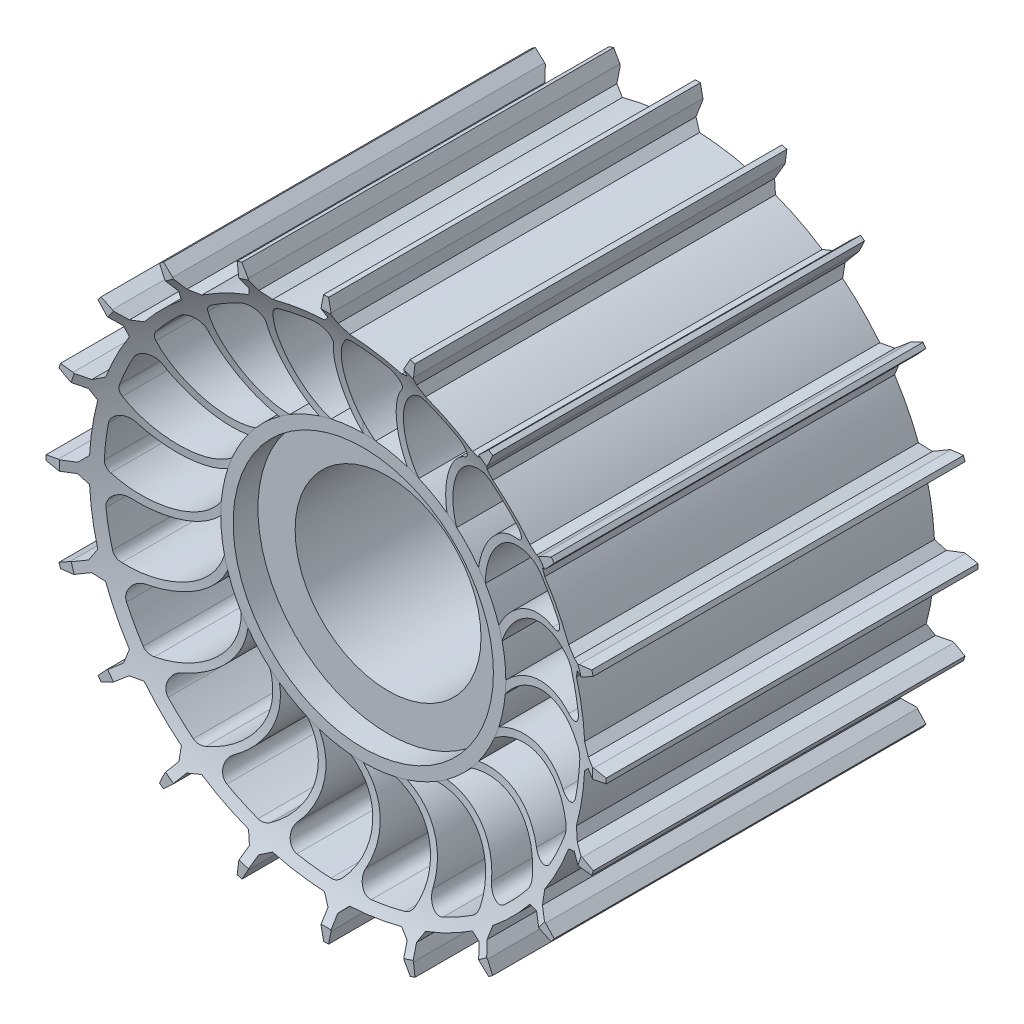
from build123d import *
from OCP.BRepFilletAPI import BRepFilletAPI_MakeChamfer

# Parameters (mm, degrees)
SKETCH1_R                      = 100
SKETCH1_R_2                    = 96
BOSS_EXTRUDE1_DEPTH            = 75
SKETCH2_W                      = 4
SKETCH2_H                      = 15
BOSS_EXTRUDE2_DEPTH            = 75
CHAMFER1_SIZE                  = 3
CHAMFER1_SIZE_2                = 3.06184942
CHAMFER2_SIZE                  = 5
CHAMFER2_SIZE2                 = 1
CIRPATTERN1_COUNT              = 20
CHAMFER1_OF_CIRPATTERN1_SIZE   = 3
CHAMFER1_OF_CIRPATTERN1_SIZE_2 = 3.06184942
CHAMFER2_OF_CIRPATTERN1_SIZE   = 5
CHAMFER2_OF_CIRPATTERN1_SIZE2  = 1
BOSS_EXTRUDE3_DEPTH            = 75
FILLET1_R                      = 5
CIRPATTERN3_COUNT              = 20
FILLET1_OF_CIRPATTERN3_R       = 5
SKETCH4_R                      = 57.5
SKETCH4_R_2                    = 37.5
BOSS_EXTRUDE4_DEPTH            = 60
SKETCH5_R                      = 52.5
CUT_EXTRUDE1_DEPTH             = 10


with BuildPart() as part:
    # Sketch1 → Boss-Extrude1 (new, symmetric)
    with BuildSketch(Plane.XY):
        Circle(SKETCH1_R)
        Circle(SKETCH1_R_2, mode=Mode.SUBTRACT)
    extrude(amount=BOSS_EXTRUDE1_DEPTH, both=True)

    # Sketch2 → Boss-Extrude2 (add, symmetric)
    with BuildSketch(Plane.XY):
        with Locations((0, 105.5)):
            Rectangle(SKETCH2_W, SKETCH2_H)
    boss_extrude2 = extrude(amount=BOSS_EXTRUDE2_DEPTH, both=True)

    # Chamfer1
    # the kernel refuses this chamfer: 3.06184942, 3 mm, written as the material it adds along each edge
    with BuildSketch(Plane(origin=(2, 99.979998, -75), x_dir=(0.9993676250587352, -0.03555769936965834, 0), z_dir=(0, 0, 1))) as chamfer1_piece_1:
        with BuildLine():
            Line((3.112646923, 0), (-CHAMFER1_SIZE * 0.0355576993697, CHAMFER1_SIZE * 0.999367625059))
            Line((-CHAMFER1_SIZE * 0.0355576993697, CHAMFER1_SIZE * 0.999367625059), (0, 0))
            ThreePointArc((0, 0), (1.601160995, 0.012101395), (3.112646923, 0))
        make_face()
    extrude(amount=150)
    with BuildSketch(Plane(origin=(-2, 99.979998, -75), x_dir=(-0.9993792848189881, -0.035228469661455174, 0), z_dir=(0, 0, 1))) as chamfer1_piece_2:
        with BuildLine():
            Line((3.046767513, 0), (-CHAMFER1_SIZE_2 * 0.035228469656, -CHAMFER1_SIZE_2 * 0.999379284664))
            Line((-CHAMFER1_SIZE_2 * 0.035228469656, -CHAMFER1_SIZE_2 * 0.999379284664), (0, 0))
            ThreePointArc((0, 0), (1.567363314, -0.011594493), (3.046767513, 0))
        make_face()
    extrude(amount=150)

    # Chamfer2: one chamfer whose edges measure the first distance from different faces: ONE call of the kernel's chamfer builder (chamfer() names one face for all edges)
    chamfer2_edges_1 = [part.edges().sort_by_distance(p)[0] for p in [
        (-2, 113, 0),
    ]]
    chamfer2_side_1 = [part.faces().sort_by_distance(p)[0] for p in [
        (-2, 108.02092371, 0),
    ]]
    chamfer2_edges_2 = [part.edges().sort_by_distance(p)[0] for p in [
        (2, 113, 0),
    ]]
    chamfer2_side_2 = [part.faces().sort_by_distance(p)[0] for p in [
        (2, 107.989999, 0),
    ]]
    chamfer2 = BRepFilletAPI_MakeChamfer(part.part.solid().wrapped)
    for e in chamfer2_edges_1:
        chamfer2.Add(CHAMFER2_SIZE, CHAMFER2_SIZE2, e.wrapped, chamfer2_side_1[0].wrapped)  # the first distance lies on this face
    for e in chamfer2_edges_2:
        chamfer2.Add(CHAMFER2_SIZE, CHAMFER2_SIZE2, e.wrapped, chamfer2_side_2[0].wrapped)  # the first distance lies on this face
    add(Compound.cast(chamfer2.Shape()), mode=Mode.REPLACE)

    # CirPattern1: Boss-Extrude2 ×20 about axis
    cirpattern1_axis = Axis((0, 0, 0), (0, 0, 1))
    for i in range(1, CIRPATTERN1_COUNT):
        add(boss_extrude2.rotate(cirpattern1_axis, i * 360 / CIRPATTERN1_COUNT))

    # Chamfer1 of CirPattern1
    # the kernel refuses this chamfer: 3.06184942, 3 mm, written as the material it adds along each edge
    with BuildSketch(Plane(origin=(-28.993405447, 95.704662585, -75), x_dir=(0.9614430253726217, 0.2750041980813028, 0), z_dir=(0, 0, 1)), Plane(origin=(-57.14873436, 82.061087984, -75), x_dir=(0.8294056835955822, 0.5586467685571493, 0), z_dir=(0, 0, 1)), Plane(origin=(-79.709946975, 60.384802337, -75), x_dir=(0.6161803346990081, 0.7876051010057122, 0), z_dir=(0, 0, 1)), Plane(origin=(-94.468594608, 32.797631512, -75), x_dir=(0.34263896146126266, 0.9394671586004203, 0), z_dir=(0, 0, 1)), Plane(origin=(-99.979998, 2, -75), x_dir=(0.03555769936965816, 0.9993676250587354, 0), z_dir=(0, 0, 1)), Plane(origin=(-95.704662585, -28.993405447, -75), x_dir=(-0.2750041980812937, 0.9614430253726242, 0), z_dir=(0, 0, 1)), Plane(origin=(-82.061087984, -57.14873436, -75), x_dir=(-0.5586467685571503, 0.8294056835955814, 0), z_dir=(0, 0, 1)), Plane(origin=(-60.384802337, -79.709946975, -75), x_dir=(-0.7876051010057117, 0.6161803346990089, 0), z_dir=(0, 0, 1)), Plane(origin=(-32.797631512, -94.468594608, -75), x_dir=(-0.939467158600422, 0.3426389614612583, 0), z_dir=(0, 0, 1)), Plane(origin=(-2, -99.979998, -75), x_dir=(-0.9993676250587352, 0.03555769936965854, 0), z_dir=(0, 0, 1)), Plane(origin=(28.993405447, -95.704662585, -75), x_dir=(-0.9614430253726228, -0.2750041980812989, 0), z_dir=(0, 0, 1)), Plane(origin=(57.14873436, -82.061087984, -75), x_dir=(-0.8294056835955806, -0.5586467685571513, 0), z_dir=(0, 0, 1)), Plane(origin=(79.709946975, -60.384802337, -75), x_dir=(-0.6161803346990089, -0.7876051010057117, 0), z_dir=(0, 0, 1)), Plane(origin=(94.468594608, -32.797631512, -75), x_dir=(-0.34263896146125755, -0.9394671586004223, 0), z_dir=(0, 0, 1)), Plane(origin=(99.979998, -2, -75), x_dir=(-0.035557699369658066, -0.9993676250587354, 0), z_dir=(0, 0, 1)), Plane(origin=(95.704662585, 28.993405447, -75), x_dir=(0.27500419808129795, -0.961443025372623, 0), z_dir=(0, 0, 1)), Plane(origin=(82.061087984, 57.14873436, -75), x_dir=(0.558646768557146, -0.8294056835955842, 0), z_dir=(0, 0, 1)), Plane(origin=(60.384802337, 79.709946975, -75), x_dir=(0.7876051010057096, -0.6161803346990117, 0), z_dir=(0, 0, 1)), Plane(origin=(32.797631512, 94.468594608, -75), x_dir=(0.9394671586004216, -0.3426389614612594, 0), z_dir=(0, 0, 1))) as chamfer1_of_cirpattern1_piece_1:
        with BuildLine():
            Line((3.112646923, 0), (-CHAMFER1_OF_CIRPATTERN1_SIZE * 0.0355576993697, CHAMFER1_OF_CIRPATTERN1_SIZE * 0.999367625059))
            Line((-CHAMFER1_OF_CIRPATTERN1_SIZE * 0.0355576993697, CHAMFER1_OF_CIRPATTERN1_SIZE * 0.999367625059), (0, 0))
            ThreePointArc((0, 0), (1.601160995, 0.012101395), (3.112646923, 0))
        make_face()
    extrude(amount=150)
    with BuildSketch(Plane(origin=(-32.797631512, 94.468594608, -75), x_dir=(-0.30901699437494673, 0.9510565162951538, 0), z_dir=(0, 0, 1)), Plane(origin=(-60.384802337, 79.709946975, -75), x_dir=(-0.5877852522924742, 0.8090169943749466, 0), z_dir=(0, 0, 1)), Plane(origin=(-82.061087984, 57.14873436, -75), x_dir=(-0.8090169943749477, 0.5877852522924727, 0), z_dir=(0, 0, 1)), Plane(origin=(-95.704662585, 28.993405447, -75), x_dir=(-0.9510565162951536, 0.30901699437494734, 0), z_dir=(0, 0, 1)), Plane(origin=(-99.979998, -2, -75), x_dir=(-1, 0, 0), z_dir=(0, 0, 1)), Plane(origin=(-94.468594608, -32.797631512, -75), x_dir=(-0.9510565162951534, -0.3090169943749481, 0), z_dir=(0, 0, 1)), Plane(origin=(-79.709946975, -60.384802337, -75), x_dir=(-0.8090169943749477, -0.5877852522924727, 0), z_dir=(0, 0, 1)), Plane(origin=(-57.14873436, -82.061087984, -75), x_dir=(-0.5877852522924727, -0.8090169943749477, 0), z_dir=(0, 0, 1)), Plane(origin=(-28.993405447, -95.704662585, -75), x_dir=(-0.30901699437494884, -0.9510565162951531, 0), z_dir=(0, 0, 1)), Plane(origin=(2, -99.979998, -75), x_dir=(0, -1, 0), z_dir=(0, 0, 1)), Plane(origin=(32.797631512, -94.468594608, -75), x_dir=(0.30901699437494595, -0.951056516295154, 0), z_dir=(0, 0, 1)), Plane(origin=(60.384802337, -79.709946975, -75), x_dir=(0.5877852522924736, -0.8090169943749471, 0), z_dir=(0, 0, 1)), Plane(origin=(82.061087984, -57.14873436, -75), x_dir=(0.8090169943749477, -0.5877852522924727, 0), z_dir=(0, 0, 1)), Plane(origin=(95.704662585, -28.993405447, -75), x_dir=(0.951056516295154, -0.30901699437494595, 0), z_dir=(0, 0, 1)), Plane(origin=(99.979998, 2, -75), x_dir=(1, 0, 0), z_dir=(0, 0, 1)), Plane(origin=(94.468594608, 32.797631512, -75), x_dir=(0.9510565162951531, 0.30901699437494884, 0), z_dir=(0, 0, 1)), Plane(origin=(79.709946975, 60.384802337, -75), x_dir=(0.8090169943749482, 0.587785252292472, 0), z_dir=(0, 0, 1)), Plane(origin=(57.14873436, 82.061087984, -75), x_dir=(0.5877852522924705, 0.8090169943749493, 0), z_dir=(0, 0, 1))) as chamfer1_of_cirpattern1_piece_2:
        with BuildLine():
            Line((CHAMFER1_OF_CIRPATTERN1_SIZE_2, 0), (-0.107332957, 3.044876338))
            ThreePointArc((-0.107332957, 3.044876338), (-0.043628515, 1.566798884), (0, 0))
            Line((0, 0), (CHAMFER1_OF_CIRPATTERN1_SIZE_2, 0))
        make_face()
    extrude(amount=150)
    with BuildSketch(Plane(origin=(28.993405447, 95.704662585, -75), x_dir=(-0.9613523768887027, 0.2753209172047083, 0), z_dir=(0, 0, 1))) as chamfer1_of_cirpattern1_piece_3:
        with BuildLine():
            Line((3.046767513, 0), (-CHAMFER1_OF_CIRPATTERN1_SIZE_2 * 0.035228469656, -CHAMFER1_OF_CIRPATTERN1_SIZE_2 * 0.999379284664))
            Line((-CHAMFER1_OF_CIRPATTERN1_SIZE_2 * 0.035228469656, -CHAMFER1_OF_CIRPATTERN1_SIZE_2 * 0.999379284664), (0, 0))
            ThreePointArc((0, 0), (1.567363314, -0.011594493), (3.046767513, 0))
        make_face()
    extrude(amount=150)

    # Chamfer2 of CirPattern1: one chamfer whose edges measure the first distance from different faces: ONE call of the kernel's chamfer builder (chamfer() names one face for all edges)
    chamfer2_of_cirpattern1_edges_1 = [part.edges().sort_by_distance(p)[0] for p in [
        (-36.821033397, 106.851352353, 0),
    ]]
    chamfer2_of_cirpattern1_side_1 = [part.faces().sort_by_distance(p)[0] for p in [
        (-35.282414207, 102.115969401, 0),
    ]]
    chamfer2_of_cirpattern1_edges_2 = [part.edges().sort_by_distance(p)[0] for p in [
        (-33.016807332, 108.08742033, 0),
    ]]
    chamfer2_of_cirpattern1_side_2 = [part.faces().sort_by_distance(p)[0] for p in [
        (-31.468631881, 103.322626232, 0),
    ]]
    chamfer2_of_cirpattern1_edges_3 = [part.edges().sort_by_distance(p)[0] for p in [
        (-68.037767498, 90.24334986, 0),
    ]]
    chamfer2_of_cirpattern1_side_3 = [part.faces().sort_by_distance(p)[0] for p in [
        (-65.111139884, 86.215192525, 0),
    ]]
    chamfer2_of_cirpattern1_edges_4 = [part.edges().sort_by_distance(p)[0] for p in [
        (-64.80169952, 92.594490869, 0),
    ]]
    chamfer2_of_cirpattern1_side_4 = [part.faces().sort_by_distance(p)[0] for p in [
        (-61.856894818, 88.541314918, 0),
    ]]
    chamfer2_of_cirpattern1_edges_5 = [part.edges().sort_by_distance(p)[0] for p in [
        (-92.594490869, 64.80169952, 0),
    ]]
    chamfer2_of_cirpattern1_side_5 = [part.faces().sort_by_distance(p)[0] for p in [
        (-88.566333534, 61.875071907, 0),
    ]]
    chamfer2_of_cirpattern1_edges_6 = [part.edges().sort_by_distance(p)[0] for p in [
        (-90.24334986, 68.037767498, 0),
    ]]
    chamfer2_of_cirpattern1_side_6 = [part.faces().sort_by_distance(p)[0] for p in [
        (-86.190173909, 65.092962796, 0),
    ]]
    chamfer2_of_cirpattern1_edges_7 = [part.edges().sort_by_distance(p)[0] for p in [
        (-108.08742033, 33.016807332, 0),
    ]]
    chamfer2_of_cirpattern1_side_7 = [part.faces().sort_by_distance(p)[0] for p in [
        (-103.352037379, 31.478188142, 0),
    ]]
    chamfer2_of_cirpattern1_edges_8 = [part.edges().sort_by_distance(p)[0] for p in [
        (-106.851352353, 36.821033397, 0),
    ]]
    chamfer2_of_cirpattern1_side_8 = [part.faces().sort_by_distance(p)[0] for p in [
        (-102.086558255, 35.272857946, 0),
    ]]
    chamfer2_of_cirpattern1_edges_9 = [part.edges().sort_by_distance(p)[0] for p in [
        (-113, -2, 0),
    ]]
    chamfer2_of_cirpattern1_side_9 = [part.faces().sort_by_distance(p)[0] for p in [
        (-108.02092371, -2, 0),
    ]]
    chamfer2_of_cirpattern1_edges_10 = [part.edges().sort_by_distance(p)[0] for p in [
        (-113, 2, 0),
    ]]
    chamfer2_of_cirpattern1_side_10 = [part.faces().sort_by_distance(p)[0] for p in [
        (-107.989999, 2, 0),
    ]]
    chamfer2_of_cirpattern1_edges_11 = [part.edges().sort_by_distance(p)[0] for p in [
        (-106.851352353, -36.821033397, 0),
    ]]
    chamfer2_of_cirpattern1_side_11 = [part.faces().sort_by_distance(p)[0] for p in [
        (-102.115969401, -35.282414207, 0),
    ]]
    chamfer2_of_cirpattern1_edges_12 = [part.edges().sort_by_distance(p)[0] for p in [
        (-108.08742033, -33.016807332, 0),
    ]]
    chamfer2_of_cirpattern1_side_12 = [part.faces().sort_by_distance(p)[0] for p in [
        (-103.322626232, -31.468631881, 0),
    ]]
    chamfer2_of_cirpattern1_edges_13 = [part.edges().sort_by_distance(p)[0] for p in [
        (-90.24334986, -68.037767498, 0),
    ]]
    chamfer2_of_cirpattern1_side_13 = [part.faces().sort_by_distance(p)[0] for p in [
        (-86.215192525, -65.111139884, 0),
    ]]
    chamfer2_of_cirpattern1_edges_14 = [part.edges().sort_by_distance(p)[0] for p in [
        (-92.594490869, -64.80169952, 0),
    ]]
    chamfer2_of_cirpattern1_side_14 = [part.faces().sort_by_distance(p)[0] for p in [
        (-88.541314918, -61.856894818, 0),
    ]]
    chamfer2_of_cirpattern1_edges_15 = [part.edges().sort_by_distance(p)[0] for p in [
        (-64.80169952, -92.594490869, 0),
    ]]
    chamfer2_of_cirpattern1_side_15 = [part.faces().sort_by_distance(p)[0] for p in [
        (-61.875071907, -88.566333534, 0),
    ]]
    chamfer2_of_cirpattern1_edges_16 = [part.edges().sort_by_distance(p)[0] for p in [
        (-68.037767498, -90.24334986, 0),
    ]]
    chamfer2_of_cirpattern1_side_16 = [part.faces().sort_by_distance(p)[0] for p in [
        (-65.092962796, -86.190173909, 0),
    ]]
    chamfer2_of_cirpattern1_edges_17 = [part.edges().sort_by_distance(p)[0] for p in [
        (-33.016807332, -108.08742033, 0),
    ]]
    chamfer2_of_cirpattern1_side_17 = [part.faces().sort_by_distance(p)[0] for p in [
        (-31.478188142, -103.352037379, 0),
    ]]
    chamfer2_of_cirpattern1_edges_18 = [part.edges().sort_by_distance(p)[0] for p in [
        (-36.821033397, -106.851352353, 0),
    ]]
    chamfer2_of_cirpattern1_side_18 = [part.faces().sort_by_distance(p)[0] for p in [
        (-35.272857946, -102.086558255, 0),
    ]]
    chamfer2_of_cirpattern1_edges_19 = [part.edges().sort_by_distance(p)[0] for p in [
        (2, -113, 0),
    ]]
    chamfer2_of_cirpattern1_side_19 = [part.faces().sort_by_distance(p)[0] for p in [
        (2, -108.02092371, 0),
    ]]
    chamfer2_of_cirpattern1_edges_20 = [part.edges().sort_by_distance(p)[0] for p in [
        (-2, -113, 0),
    ]]
    chamfer2_of_cirpattern1_side_20 = [part.faces().sort_by_distance(p)[0] for p in [
        (-2, -107.989999, 0),
    ]]
    chamfer2_of_cirpattern1_edges_21 = [part.edges().sort_by_distance(p)[0] for p in [
        (36.821033397, -106.851352353, 0),
    ]]
    chamfer2_of_cirpattern1_side_21 = [part.faces().sort_by_distance(p)[0] for p in [
        (35.282414207, -102.115969401, 0),
    ]]
    chamfer2_of_cirpattern1_edges_22 = [part.edges().sort_by_distance(p)[0] for p in [
        (33.016807332, -108.08742033, 0),
    ]]
    chamfer2_of_cirpattern1_side_22 = [part.faces().sort_by_distance(p)[0] for p in [
        (31.468631881, -103.322626232, 0),
    ]]
    chamfer2_of_cirpattern1_edges_23 = [part.edges().sort_by_distance(p)[0] for p in [
        (68.037767498, -90.24334986, 0),
    ]]
    chamfer2_of_cirpattern1_side_23 = [part.faces().sort_by_distance(p)[0] for p in [
        (65.111139884, -86.215192525, 0),
    ]]
    chamfer2_of_cirpattern1_edges_24 = [part.edges().sort_by_distance(p)[0] for p in [
        (64.80169952, -92.594490869, 0),
    ]]
    chamfer2_of_cirpattern1_side_24 = [part.faces().sort_by_distance(p)[0] for p in [
        (61.856894818, -88.541314918, 0),
    ]]
    chamfer2_of_cirpattern1_edges_25 = [part.edges().sort_by_distance(p)[0] for p in [
        (92.594490869, -64.80169952, 0),
    ]]
    chamfer2_of_cirpattern1_side_25 = [part.faces().sort_by_distance(p)[0] for p in [
        (88.566333534, -61.875071907, 0),
    ]]
    chamfer2_of_cirpattern1_edges_26 = [part.edges().sort_by_distance(p)[0] for p in [
        (90.24334986, -68.037767498, 0),
    ]]
    chamfer2_of_cirpattern1_side_26 = [part.faces().sort_by_distance(p)[0] for p in [
        (86.190173909, -65.092962796, 0),
    ]]
    chamfer2_of_cirpattern1_edges_27 = [part.edges().sort_by_distance(p)[0] for p in [
        (108.08742033, -33.016807332, 0),
    ]]
    chamfer2_of_cirpattern1_side_27 = [part.faces().sort_by_distance(p)[0] for p in [
        (103.352037379, -31.478188142, 0),
    ]]
    chamfer2_of_cirpattern1_edges_28 = [part.edges().sort_by_distance(p)[0] for p in [
        (106.851352353, -36.821033397, 0),
    ]]
    chamfer2_of_cirpattern1_side_28 = [part.faces().sort_by_distance(p)[0] for p in [
        (102.086558255, -35.272857946, 0),
    ]]
    chamfer2_of_cirpattern1_edges_29 = [part.edges().sort_by_distance(p)[0] for p in [
        (113, 2, 0),
    ]]
    chamfer2_of_cirpattern1_side_29 = [part.faces().sort_by_distance(p)[0] for p in [
        (108.02092371, 2, 0),
    ]]
    chamfer2_of_cirpattern1_edges_30 = [part.edges().sort_by_distance(p)[0] for p in [
        (113, -2, 0),
    ]]
    chamfer2_of_cirpattern1_side_30 = [part.faces().sort_by_distance(p)[0] for p in [
        (107.989999, -2, 0),
    ]]
    chamfer2_of_cirpattern1_edges_31 = [part.edges().sort_by_distance(p)[0] for p in [
        (106.851352353, 36.821033397, 0),
    ]]
    chamfer2_of_cirpattern1_side_31 = [part.faces().sort_by_distance(p)[0] for p in [
        (102.115969401, 35.282414207, 0),
    ]]
    chamfer2_of_cirpattern1_edges_32 = [part.edges().sort_by_distance(p)[0] for p in [
        (108.08742033, 33.016807332, 0),
    ]]
    chamfer2_of_cirpattern1_side_32 = [part.faces().sort_by_distance(p)[0] for p in [
        (103.322626232, 31.468631881, 0),
    ]]
    chamfer2_of_cirpattern1_edges_33 = [part.edges().sort_by_distance(p)[0] for p in [
        (90.24334986, 68.037767498, 0),
    ]]
    chamfer2_of_cirpattern1_side_33 = [part.faces().sort_by_distance(p)[0] for p in [
        (86.215192525, 65.111139884, 0),
    ]]
    chamfer2_of_cirpattern1_edges_34 = [part.edges().sort_by_distance(p)[0] for p in [
        (92.594490869, 64.80169952, 0),
    ]]
    chamfer2_of_cirpattern1_side_34 = [part.faces().sort_by_distance(p)[0] for p in [
        (88.541314918, 61.856894818, 0),
    ]]
    chamfer2_of_cirpattern1_edges_35 = [part.edges().sort_by_distance(p)[0] for p in [
        (64.80169952, 92.594490869, 0),
    ]]
    chamfer2_of_cirpattern1_side_35 = [part.faces().sort_by_distance(p)[0] for p in [
        (61.875071907, 88.566333534, 0),
    ]]
    chamfer2_of_cirpattern1_edges_36 = [part.edges().sort_by_distance(p)[0] for p in [
        (68.037767498, 90.24334986, 0),
    ]]
    chamfer2_of_cirpattern1_side_36 = [part.faces().sort_by_distance(p)[0] for p in [
        (65.092962796, 86.190173909, 0),
    ]]
    chamfer2_of_cirpattern1_edges_37 = [part.edges().sort_by_distance(p)[0] for p in [
        (33.016807332, 108.08742033, 0),
    ]]
    chamfer2_of_cirpattern1_side_37 = [part.faces().sort_by_distance(p)[0] for p in [
        (31.478188142, 103.352037379, 0),
    ]]
    chamfer2_of_cirpattern1_edges_38 = [part.edges().sort_by_distance(p)[0] for p in [
        (36.821033397, 106.851352353, 0),
    ]]
    chamfer2_of_cirpattern1_side_38 = [part.faces().sort_by_distance(p)[0] for p in [
        (35.272857946, 102.086558255, 0),
    ]]
    chamfer2_of_cirpattern1 = BRepFilletAPI_MakeChamfer(part.part.solid().wrapped)
    for e in chamfer2_of_cirpattern1_edges_1:
        chamfer2_of_cirpattern1.Add(CHAMFER2_OF_CIRPATTERN1_SIZE, CHAMFER2_OF_CIRPATTERN1_SIZE2, e.wrapped, chamfer2_of_cirpattern1_side_1[0].wrapped)  # the first distance lies on this face
    for e in chamfer2_of_cirpattern1_edges_2:
        chamfer2_of_cirpattern1.Add(CHAMFER2_OF_CIRPATTERN1_SIZE, CHAMFER2_OF_CIRPATTERN1_SIZE2, e.wrapped, chamfer2_of_cirpattern1_side_2[0].wrapped)  # the first distance lies on this face
    for e in chamfer2_of_cirpattern1_edges_3:
        chamfer2_of_cirpattern1.Add(CHAMFER2_OF_CIRPATTERN1_SIZE, CHAMFER2_OF_CIRPATTERN1_SIZE2, e.wrapped, chamfer2_of_cirpattern1_side_3[0].wrapped)  # the first distance lies on this face
    for e in chamfer2_of_cirpattern1_edges_4:
        chamfer2_of_cirpattern1.Add(CHAMFER2_OF_CIRPATTERN1_SIZE, CHAMFER2_OF_CIRPATTERN1_SIZE2, e.wrapped, chamfer2_of_cirpattern1_side_4[0].wrapped)  # the first distance lies on this face
    for e in chamfer2_of_cirpattern1_edges_5:
        chamfer2_of_cirpattern1.Add(CHAMFER2_OF_CIRPATTERN1_SIZE, CHAMFER2_OF_CIRPATTERN1_SIZE2, e.wrapped, chamfer2_of_cirpattern1_side_5[0].wrapped)  # the first distance lies on this face
    for e in chamfer2_of_cirpattern1_edges_6:
        chamfer2_of_cirpattern1.Add(CHAMFER2_OF_CIRPATTERN1_SIZE, CHAMFER2_OF_CIRPATTERN1_SIZE2, e.wrapped, chamfer2_of_cirpattern1_side_6[0].wrapped)  # the first distance lies on this face
    for e in chamfer2_of_cirpattern1_edges_7:
        chamfer2_of_cirpattern1.Add(CHAMFER2_OF_CIRPATTERN1_SIZE, CHAMFER2_OF_CIRPATTERN1_SIZE2, e.wrapped, chamfer2_of_cirpattern1_side_7[0].wrapped)  # the first distance lies on this face
    for e in chamfer2_of_cirpattern1_edges_8:
        chamfer2_of_cirpattern1.Add(CHAMFER2_OF_CIRPATTERN1_SIZE, CHAMFER2_OF_CIRPATTERN1_SIZE2, e.wrapped, chamfer2_of_cirpattern1_side_8[0].wrapped)  # the first distance lies on this face
    for e in chamfer2_of_cirpattern1_edges_9:
        chamfer2_of_cirpattern1.Add(CHAMFER2_OF_CIRPATTERN1_SIZE, CHAMFER2_OF_CIRPATTERN1_SIZE2, e.wrapped, chamfer2_of_cirpattern1_side_9[0].wrapped)  # the first distance lies on this face
    for e in chamfer2_of_cirpattern1_edges_10:
        chamfer2_of_cirpattern1.Add(CHAMFER2_OF_CIRPATTERN1_SIZE, CHAMFER2_OF_CIRPATTERN1_SIZE2, e.wrapped, chamfer2_of_cirpattern1_side_10[0].wrapped)  # the first distance lies on this face
    for e in chamfer2_of_cirpattern1_edges_11:
        chamfer2_of_cirpattern1.Add(CHAMFER2_OF_CIRPATTERN1_SIZE, CHAMFER2_OF_CIRPATTERN1_SIZE2, e.wrapped, chamfer2_of_cirpattern1_side_11[0].wrapped)  # the first distance lies on this face
    for e in chamfer2_of_cirpattern1_edges_12:
        chamfer2_of_cirpattern1.Add(CHAMFER2_OF_CIRPATTERN1_SIZE, CHAMFER2_OF_CIRPATTERN1_SIZE2, e.wrapped, chamfer2_of_cirpattern1_side_12[0].wrapped)  # the first distance lies on this face
    for e in chamfer2_of_cirpattern1_edges_13:
        chamfer2_of_cirpattern1.Add(CHAMFER2_OF_CIRPATTERN1_SIZE, CHAMFER2_OF_CIRPATTERN1_SIZE2, e.wrapped, chamfer2_of_cirpattern1_side_13[0].wrapped)  # the first distance lies on this face
    for e in chamfer2_of_cirpattern1_edges_14:
        chamfer2_of_cirpattern1.Add(CHAMFER2_OF_CIRPATTERN1_SIZE, CHAMFER2_OF_CIRPATTERN1_SIZE2, e.wrapped, chamfer2_of_cirpattern1_side_14[0].wrapped)  # the first distance lies on this face
    for e in chamfer2_of_cirpattern1_edges_15:
        chamfer2_of_cirpattern1.Add(CHAMFER2_OF_CIRPATTERN1_SIZE, CHAMFER2_OF_CIRPATTERN1_SIZE2, e.wrapped, chamfer2_of_cirpattern1_side_15[0].wrapped)  # the first distance lies on this face
    for e in chamfer2_of_cirpattern1_edges_16:
        chamfer2_of_cirpattern1.Add(CHAMFER2_OF_CIRPATTERN1_SIZE, CHAMFER2_OF_CIRPATTERN1_SIZE2, e.wrapped, chamfer2_of_cirpattern1_side_16[0].wrapped)  # the first distance lies on this face
    for e in chamfer2_of_cirpattern1_edges_17:
        chamfer2_of_cirpattern1.Add(CHAMFER2_OF_CIRPATTERN1_SIZE, CHAMFER2_OF_CIRPATTERN1_SIZE2, e.wrapped, chamfer2_of_cirpattern1_side_17[0].wrapped)  # the first distance lies on this face
    for e in chamfer2_of_cirpattern1_edges_18:
        chamfer2_of_cirpattern1.Add(CHAMFER2_OF_CIRPATTERN1_SIZE, CHAMFER2_OF_CIRPATTERN1_SIZE2, e.wrapped, chamfer2_of_cirpattern1_side_18[0].wrapped)  # the first distance lies on this face
    for e in chamfer2_of_cirpattern1_edges_19:
        chamfer2_of_cirpattern1.Add(CHAMFER2_OF_CIRPATTERN1_SIZE, CHAMFER2_OF_CIRPATTERN1_SIZE2, e.wrapped, chamfer2_of_cirpattern1_side_19[0].wrapped)  # the first distance lies on this face
    for e in chamfer2_of_cirpattern1_edges_20:
        chamfer2_of_cirpattern1.Add(CHAMFER2_OF_CIRPATTERN1_SIZE, CHAMFER2_OF_CIRPATTERN1_SIZE2, e.wrapped, chamfer2_of_cirpattern1_side_20[0].wrapped)  # the first distance lies on this face
    for e in chamfer2_of_cirpattern1_edges_21:
        chamfer2_of_cirpattern1.Add(CHAMFER2_OF_CIRPATTERN1_SIZE, CHAMFER2_OF_CIRPATTERN1_SIZE2, e.wrapped, chamfer2_of_cirpattern1_side_21[0].wrapped)  # the first distance lies on this face
    for e in chamfer2_of_cirpattern1_edges_22:
        chamfer2_of_cirpattern1.Add(CHAMFER2_OF_CIRPATTERN1_SIZE, CHAMFER2_OF_CIRPATTERN1_SIZE2, e.wrapped, chamfer2_of_cirpattern1_side_22[0].wrapped)  # the first distance lies on this face
    for e in chamfer2_of_cirpattern1_edges_23:
        chamfer2_of_cirpattern1.Add(CHAMFER2_OF_CIRPATTERN1_SIZE, CHAMFER2_OF_CIRPATTERN1_SIZE2, e.wrapped, chamfer2_of_cirpattern1_side_23[0].wrapped)  # the first distance lies on this face
    for e in chamfer2_of_cirpattern1_edges_24:
        chamfer2_of_cirpattern1.Add(CHAMFER2_OF_CIRPATTERN1_SIZE, CHAMFER2_OF_CIRPATTERN1_SIZE2, e.wrapped, chamfer2_of_cirpattern1_side_24[0].wrapped)  # the first distance lies on this face
    for e in chamfer2_of_cirpattern1_edges_25:
        chamfer2_of_cirpattern1.Add(CHAMFER2_OF_CIRPATTERN1_SIZE, CHAMFER2_OF_CIRPATTERN1_SIZE2, e.wrapped, chamfer2_of_cirpattern1_side_25[0].wrapped)  # the first distance lies on this face
    for e in chamfer2_of_cirpattern1_edges_26:
        chamfer2_of_cirpattern1.Add(CHAMFER2_OF_CIRPATTERN1_SIZE, CHAMFER2_OF_CIRPATTERN1_SIZE2, e.wrapped, chamfer2_of_cirpattern1_side_26[0].wrapped)  # the first distance lies on this face
    for e in chamfer2_of_cirpattern1_edges_27:
        chamfer2_of_cirpattern1.Add(CHAMFER2_OF_CIRPATTERN1_SIZE, CHAMFER2_OF_CIRPATTERN1_SIZE2, e.wrapped, chamfer2_of_cirpattern1_side_27[0].wrapped)  # the first distance lies on this face
    for e in chamfer2_of_cirpattern1_edges_28:
        chamfer2_of_cirpattern1.Add(CHAMFER2_OF_CIRPATTERN1_SIZE, CHAMFER2_OF_CIRPATTERN1_SIZE2, e.wrapped, chamfer2_of_cirpattern1_side_28[0].wrapped)  # the first distance lies on this face
    for e in chamfer2_of_cirpattern1_edges_29:
        chamfer2_of_cirpattern1.Add(CHAMFER2_OF_CIRPATTERN1_SIZE, CHAMFER2_OF_CIRPATTERN1_SIZE2, e.wrapped, chamfer2_of_cirpattern1_side_29[0].wrapped)  # the first distance lies on this face
    for e in chamfer2_of_cirpattern1_edges_30:
        chamfer2_of_cirpattern1.Add(CHAMFER2_OF_CIRPATTERN1_SIZE, CHAMFER2_OF_CIRPATTERN1_SIZE2, e.wrapped, chamfer2_of_cirpattern1_side_30[0].wrapped)  # the first distance lies on this face
    for e in chamfer2_of_cirpattern1_edges_31:
        chamfer2_of_cirpattern1.Add(CHAMFER2_OF_CIRPATTERN1_SIZE, CHAMFER2_OF_CIRPATTERN1_SIZE2, e.wrapped, chamfer2_of_cirpattern1_side_31[0].wrapped)  # the first distance lies on this face
    for e in chamfer2_of_cirpattern1_edges_32:
        chamfer2_of_cirpattern1.Add(CHAMFER2_OF_CIRPATTERN1_SIZE, CHAMFER2_OF_CIRPATTERN1_SIZE2, e.wrapped, chamfer2_of_cirpattern1_side_32[0].wrapped)  # the first distance lies on this face
    for e in chamfer2_of_cirpattern1_edges_33:
        chamfer2_of_cirpattern1.Add(CHAMFER2_OF_CIRPATTERN1_SIZE, CHAMFER2_OF_CIRPATTERN1_SIZE2, e.wrapped, chamfer2_of_cirpattern1_side_33[0].wrapped)  # the first distance lies on this face
    for e in chamfer2_of_cirpattern1_edges_34:
        chamfer2_of_cirpattern1.Add(CHAMFER2_OF_CIRPATTERN1_SIZE, CHAMFER2_OF_CIRPATTERN1_SIZE2, e.wrapped, chamfer2_of_cirpattern1_side_34[0].wrapped)  # the first distance lies on this face
    for e in chamfer2_of_cirpattern1_edges_35:
        chamfer2_of_cirpattern1.Add(CHAMFER2_OF_CIRPATTERN1_SIZE, CHAMFER2_OF_CIRPATTERN1_SIZE2, e.wrapped, chamfer2_of_cirpattern1_side_35[0].wrapped)  # the first distance lies on this face
    for e in chamfer2_of_cirpattern1_edges_36:
        chamfer2_of_cirpattern1.Add(CHAMFER2_OF_CIRPATTERN1_SIZE, CHAMFER2_OF_CIRPATTERN1_SIZE2, e.wrapped, chamfer2_of_cirpattern1_side_36[0].wrapped)  # the first distance lies on this face
    for e in chamfer2_of_cirpattern1_edges_37:
        chamfer2_of_cirpattern1.Add(CHAMFER2_OF_CIRPATTERN1_SIZE, CHAMFER2_OF_CIRPATTERN1_SIZE2, e.wrapped, chamfer2_of_cirpattern1_side_37[0].wrapped)  # the first distance lies on this face
    for e in chamfer2_of_cirpattern1_edges_38:
        chamfer2_of_cirpattern1.Add(CHAMFER2_OF_CIRPATTERN1_SIZE, CHAMFER2_OF_CIRPATTERN1_SIZE2, e.wrapped, chamfer2_of_cirpattern1_side_38[0].wrapped)  # the first distance lies on this face
    add(Compound.cast(chamfer2_of_cirpattern1.Shape()), mode=Mode.REPLACE)

    # Sketch2<3> → Boss-Extrude3 (add, symmetric)
    with BuildSketch(Plane.XY):
        with BuildLine():
            Line((4.676716728, 98), (2, 98))
            Line((2, 98), (0, 98))
            ThreePointArc((0, 98), (-8.662536361, 77.75), (0, 57.5))
            ThreePointArc((0, 57.5), (2.492271428, 57.445962287), (4.97985845, 57.283950718))
            ThreePointArc((4.97985845, 57.283950718), (-5.66184349, 77.563873567), (4.676716728, 98))
        make_face()
    boss_extrude3 = extrude(amount=BOSS_EXTRUDE3_DEPTH, both=True)

    # Fillet1
    fillet1_edges = [part.edges().sort_by_distance(p)[0] for p in [
        (-1.914213642, 95.980913655, 0),
        (2.223811435, 95.974239579, 0),
    ]]
    fillet(fillet1_edges, radius=FILLET1_R)

    # CirPattern3: Boss-Extrude3 ×20 about axis
    cirpattern3_axis = Axis((0, 0, 0), (0, 0, 1))
    for i in range(1, CIRPATTERN3_COUNT):
        add(boss_extrude3.rotate(cirpattern3_axis, i * 360 / CIRPATTERN3_COUNT))

    # Fillet1 of CirPattern3
    fillet1_of_cirpattern3_edges = [part.edges().sort_by_distance(p)[0] for p in [
        (-31.480258813, 90.691748826, 0),
        (-27.542700696, 91.964121473, 0),
        (-57.964796916, 76.525043734, 0),
        (-54.613141381, 78.951914407, 0),
        (-78.775336832, 54.867534181, 0),
        (-76.337667276, 58.211343867, 0),
        (-91.874797918, 27.839208097, 0),
        (-90.589730422, 31.772641408, 0),
        (-95.980913655, -1.914213642, 0),
        (-95.974239579, 2.223811435, 0),
        (-90.691748826, -31.480258813, 0),
        (-91.964121473, -27.542700696, 0),
        (-76.525043734, -57.964796916, 0),
        (-78.951914407, -54.613141381, 0),
        (-54.867534181, -78.775336832, 0),
        (-58.211343867, -76.337667276, 0),
        (-27.839208097, -91.874797918, 0),
        (-31.772641408, -90.589730422, 0),
        (1.914213642, -95.980913655, 0),
        (-2.223811435, -95.974239579, 0),
        (31.480258813, -90.691748826, 0),
        (27.542700696, -91.964121473, 0),
        (57.964796916, -76.525043734, 0),
        (54.613141381, -78.951914407, 0),
        (78.775336832, -54.867534181, 0),
        (76.337667276, -58.211343867, 0),
        (91.874797918, -27.839208097, 0),
        (90.589730422, -31.772641408, 0),
        (95.980913655, 1.914213642, 0),
        (95.974239579, -2.223811435, 0),
        (90.691748826, 31.480258813, 0),
        (91.964121473, 27.542700696, 0),
        (76.525043734, 57.964796916, 0),
        (78.951914407, 54.613141381, 0),
        (54.867534181, 78.775336832, 0),
        (58.211343867, 76.337667276, 0),
        (27.839208097, 91.874797918, 0),
        (31.772641408, 90.589730422, 0),
    ]]
    fillet(fillet1_of_cirpattern3_edges, radius=FILLET1_OF_CIRPATTERN3_R)

    # Sketch3 → Cut-Revolve1 (revolve, cut)
    with BuildSketch(Plane(origin=(0, 0, 0), x_dir=(0, 0, -1), z_dir=(1, 0, 0))):
        with BuildLine():
            Line((-75, 57.5), (-60, 57.5))
            ThreePointArc((-60, 57.5), (-63.830779092, 83.600766272), (-75, 107.5))
            Line((-75, 107.5), (-75, 57.5))
        make_face()
        with BuildLine():
            Line((75, 57.5), (60, 57.5))
            ThreePointArc((60, 57.5), (63.830779092, 83.600766272), (75, 107.5))
            Line((75, 107.5), (75, 57.5))
        make_face()
    revolve(axis=Axis((0, 0, 0), (0, 0, 1)), mode=Mode.SUBTRACT)

    # Sketch4 → Boss-Extrude4 (add, symmetric)
    with BuildSketch(Plane.XY):
        Circle(SKETCH4_R)
        with Locations(Location((0, 0, 0), (0, 0, 180))):
            Circle(SKETCH4_R_2, mode=Mode.SUBTRACT)
    extrude(amount=BOSS_EXTRUDE4_DEPTH, both=True)

    # Sketch5 → Cut-Extrude1 (cut)
    with BuildSketch(Plane.XY.offset(60)):
        Circle(SKETCH5_R)
    cut_extrude1 = extrude(amount=-CUT_EXTRUDE1_DEPTH, mode=Mode.SUBTRACT)

    # Mirror1: Cut-Extrude1 across plane
    add(cut_extrude1.mirror(Plane.XY), mode=Mode.SUBTRACT)


solid = part.part
